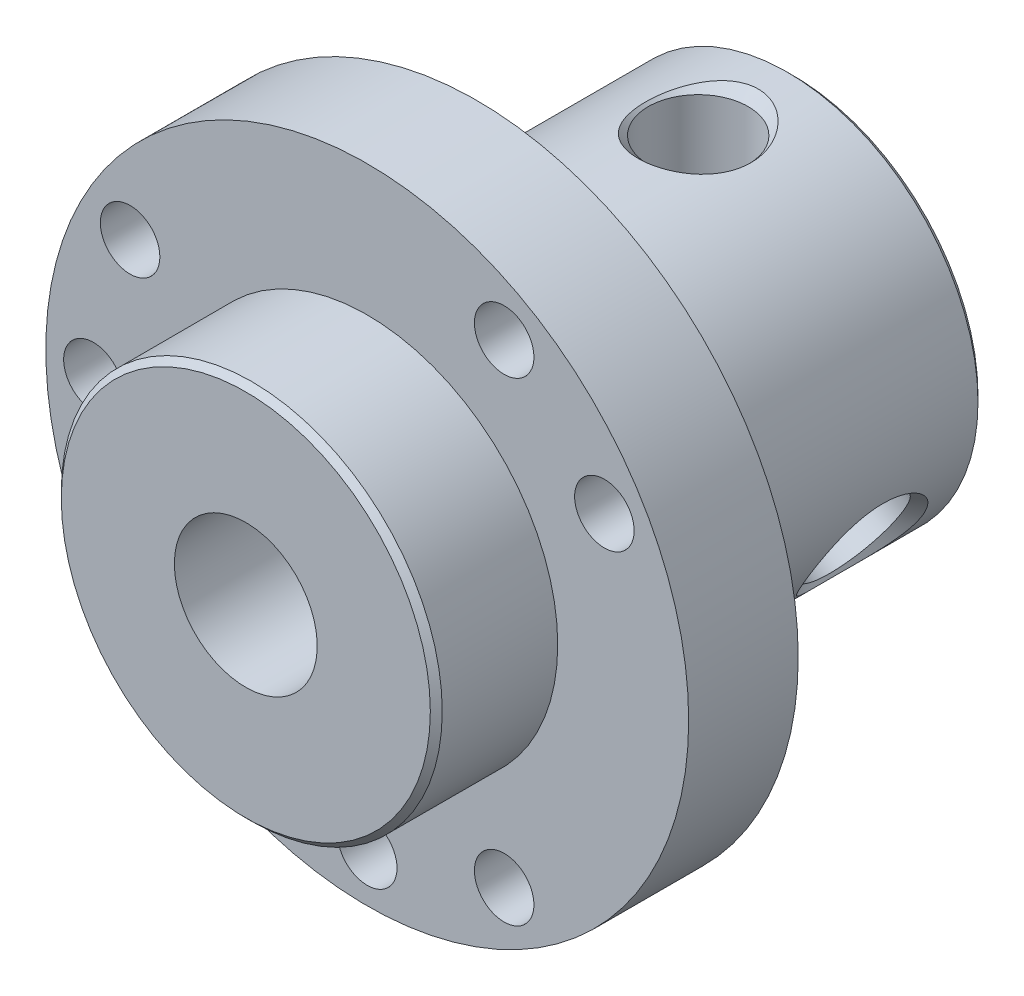
from build123d import *

# Parameters (mm, degrees)
SKETCH_2_R          = 3
CUT_EXTRUDE_1_DEPTH = 30.891470355
CHAMFER_1_SIZE      = 0.25
HOLE_WIZARD_M3_1_D  = 2.5


# Read off the part's stored shape, not the designer's step: M5 螺纹孔1
with BuildPart() as part:
    # 草图1 → 旋转1 (revolve)
    with BuildSketch(Plane(origin=(0, 0, 0), x_dir=(0, 0, -1), z_dir=(1, 0, 0)), mode=Mode.PRIVATE) as revolve_1_sk:
        Polygon((0, 0), (0, 8), (5.1, 8), (5.1, 13.5), (9.7, 13.5), (9.7, 8), (23, 8), (23, 0), align=None)
    revolve(revolve_1_sk.sketch.rotate(Axis((0, 0, 81.160359106), (0, 0, -1)), 90), axis=Axis((0, 0, 81.160359106), (0, 0, -1)))

    # 草图2 → 切除-拉伸1 (cut, through all)
    with BuildSketch(Plane(origin=(0, 0, -23), x_dir=(-1, 0, 0), z_dir=(0, 0, -1))):
        Circle(SKETCH_2_R)
    extrude(amount=-CUT_EXTRUDE_1_DEPTH, mode=Mode.SUBTRACT)

    # M5 螺纹孔1 outline → M5 螺纹孔1 (revolve, cut)
    with BuildSketch(Plane.XY.offset(-19)):
        Polygon((2.52511429, 8.00011429), (0, 8.00011429), (0, 2.141949197), (2.1, 2.141949197), (2.1, 7.575), align=None)
    revolve(axis=Axis((0, 0, -19), (0, 1, 0)), mode=Mode.SUBTRACT)

    # Hole Wizard M5 _1 2 outline → Hole Wizard M5 _1 2 (revolve, cut)
    with BuildSketch(Plane(origin=(0, 0, -19), x_dir=(0.49999999999999767, 0.86602540378444, 0), z_dir=(0, 0, -1))):
        Polygon((2.525122236, 8.000122236), (0, 8.000122236), (0, 2.1419531), (2.1, 2.1419531), (2.1, 7.575), align=None)
    revolve(axis=Axis((0, 0, -19), (0.8660254037844403, -0.4999999999999978, 0)), mode=Mode.SUBTRACT)

    # 倒角1
    chamfer_1_edges = [part.edges().sort_by_distance(p)[0] for p in [
        (3, 0, -23),
        (-8, 0, -23),
        (-8, 0, 0),
    ]]
    chamfer(chamfer_1_edges, length=CHAMFER_1_SIZE)

    # M3 螺纹孔1 (through all)
    with Locations(Plane(origin=(-11.5, 0, -5.1), x_dir=(1, 0, 0), z_dir=(0, 0, 1))):
        with Locations((0, 0), (17.25, -9.959292144), (17.25, 9.959292144), (1.540707856, 5.75), (11.5, -11.5), (21.459292144, 5.75)):
            Hole(HOLE_WIZARD_M3_1_D / 2)


solid = part.part
